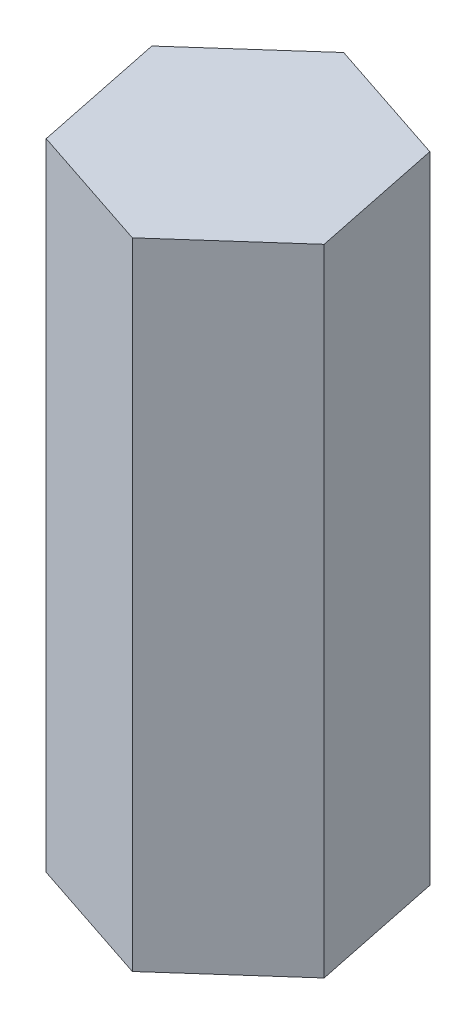
from build123d import *

# Parameters (mm, degrees)
BOSS_EXTRUDE1_DEPTH = 34.29


with BuildPart() as part:
    # Sketch1 → Boss-Extrude1 (new body)
    with BuildSketch(Plane(origin=(0, 0, 0), x_dir=(1, 0, 0), z_dir=(0, 1, 0))):
        Polygon((5.480265536, 4.871347143), (-1.478577609, 7.181722745), (-6.958843145, 2.310375602), (-5.480265536, -4.871347143), (1.478577609, -7.181722745), (6.958843145, -2.310375602), align=None)
    extrude(amount=BOSS_EXTRUDE1_DEPTH)


solid = part.part
